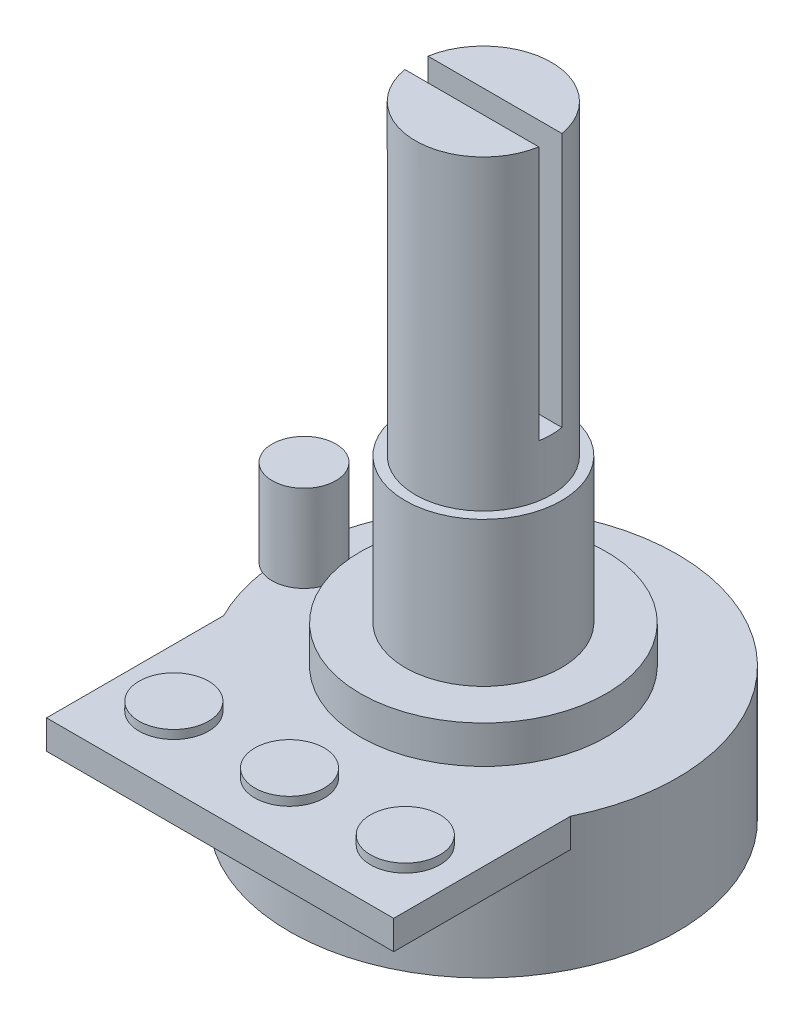
from build123d import *

# Parameters (mm, degrees)
SKETCH1_R            = 5.3975
BOSS_EXTRUDE1_DEPTH  = 1.651
SKETCH2_R            = 8.509
BOSS_EXTRUDE2_DEPTH  = 5.842
SKETCH3_R            = 3.429
BOSS_EXTRUDE3_DEPTH  = 6.35
SKETCH6_R            = 2.9845
BOSS_EXTRUDE5_DEPTH  = 13.462
SKETCH12_W           = 6.35
SKETCH12_H           = 1.016
CUT_EXTRUDE1_DEPTH   = 11.176
BOSS_EXTRUDE7_DEPTH  = 1.27
SKETCH14_R           = 1.524
BOSS_EXTRUDE11_DEPTH = 1.016
LPATTERN2_START      = -3.302
LPATTERN2_OUTLINE_R  = 1.524
LPATTERN2_DEPTH      = 2.032
LPATTERN2_START_2    = -1.651
LPATTERN2_2_DEPTH    = 0.381
SKETCH4_R            = 1.397
BOSS_EXTRUDE8_DEPTH  = 3.81


# Read off the part's stored shape, not the designer's step: LPattern2
with BuildPart() as part:
    # Sketch1 → Boss-Extrude1 (new body)
    with BuildSketch(Plane(origin=(0, 0, 0), x_dir=(1, 0, 0), z_dir=(0, 1, 0))):
        with Locations(Location((0, 0, 0), (0, 0, 270))):
            Circle(SKETCH1_R)
    extrude(amount=-BOSS_EXTRUDE1_DEPTH)

    # Sketch2 → Boss-Extrude2 (add)
    with BuildSketch(Plane.XZ.offset(1.651)):
        with Locations(Location((0, 0, 0), (0, 0, 270))):
            Circle(SKETCH2_R)
    extrude(amount=BOSS_EXTRUDE2_DEPTH)

    # Sketch3 → Boss-Extrude3 (add)
    with BuildSketch(Plane(origin=(0, 0, 0), x_dir=(1, 0, 0), z_dir=(0, 1, 0))):
        with Locations(Location((0, 0, 0), (0, 0, 270))):
            Circle(SKETCH3_R)
    extrude(amount=BOSS_EXTRUDE3_DEPTH)

    # Sketch6 → Boss-Extrude5 (add)
    with BuildSketch(Plane(origin=(0, 6.35, 0), x_dir=(1, 0, 0), z_dir=(0, 1, 0))):
        with Locations(Location((0, 0, 0), (0, 0, 270))):
            Circle(SKETCH6_R)
    extrude(amount=BOSS_EXTRUDE5_DEPTH)

    # Sketch12 → Cut-Extrude1 (cut)
    with BuildSketch(Plane(origin=(0, 19.812, 0), x_dir=(1, 0, 0), z_dir=(0, 1, 0))):
        Rectangle(SKETCH12_W, SKETCH12_H)
    extrude(amount=-CUT_EXTRUDE1_DEPTH, mode=Mode.SUBTRACT)

    # Sketch11 → Boss-Extrude7 (add)
    with BuildSketch(Plane.XZ.offset(1.651)):
        with BuildLine():
            Line((-7.62, 3.175), (-7.62, 11.557))
            Line((-7.62, 11.557), (7.62, 11.557))
            Line((7.62, 11.557), (7.62, 3.175))
            ThreePointArc((7.62, 3.175), (0, -8.255), (-7.62, 3.175))
        make_face()
    extrude(amount=BOSS_EXTRUDE7_DEPTH)

    # Sketch14 → Boss-Extrude11 (add, symmetric)
    with BuildSketch(Plane(origin=(0, -2.286, 0), x_dir=(1, 0, 0), z_dir=(0, 1, 0))):
        with Locations(Location((-5.08, -8.509, 0), (0, 0, 90))):
            Circle(SKETCH14_R)
    extrude(amount=BOSS_EXTRUDE11_DEPTH, both=True)

    # LPattern2 outline → LPattern2 (add)
    with BuildSketch(Plane(origin=(0, 0, 0), x_dir=(1, 0, 0), z_dir=(0, 1, 0)).offset(LPATTERN2_START)):
        with Locations((0, -8.509)):
            Circle(LPATTERN2_OUTLINE_R)
        with BuildLine():
            ThreePointArc((5.330666391, -7.005756054), (4.298782485, -9.817539336), (6.284337715, -7.575112069))
            ThreePointArc((6.284337715, -7.575112069), (5.798202212, -7.306011296), (5.330666391, -7.005756054))
        make_face()
    extrude(amount=LPATTERN2_DEPTH)

    # LPattern2 2 outline → LPattern2 2 (add)
    with BuildSketch(Plane(origin=(0, 0, 0), x_dir=(1, 0, 0), z_dir=(0, 1, 0)).offset(LPATTERN2_START_2)):
        with BuildLine():
            ThreePointArc((5.330666391, -7.005756054), (5.798202212, -7.306011296), (6.284337715, -7.575112069))
            ThreePointArc((6.284337715, -7.575112069), (5.861217515, -7.200460664), (5.330666391, -7.005756054))
        make_face()
    extrude(amount=LPATTERN2_2_DEPTH)

    # Sketch4 → Boss-Extrude8 (add)
    with BuildSketch(Plane(origin=(0, -1.651, 0), x_dir=(1, 0, 0), z_dir=(0, 1, 0))):
        with Locations(Location((-7.874, 0, 0), (0, 0, 112.591863996))):
            Circle(SKETCH4_R)
    extrude(amount=BOSS_EXTRUDE8_DEPTH)


solid = part.part
